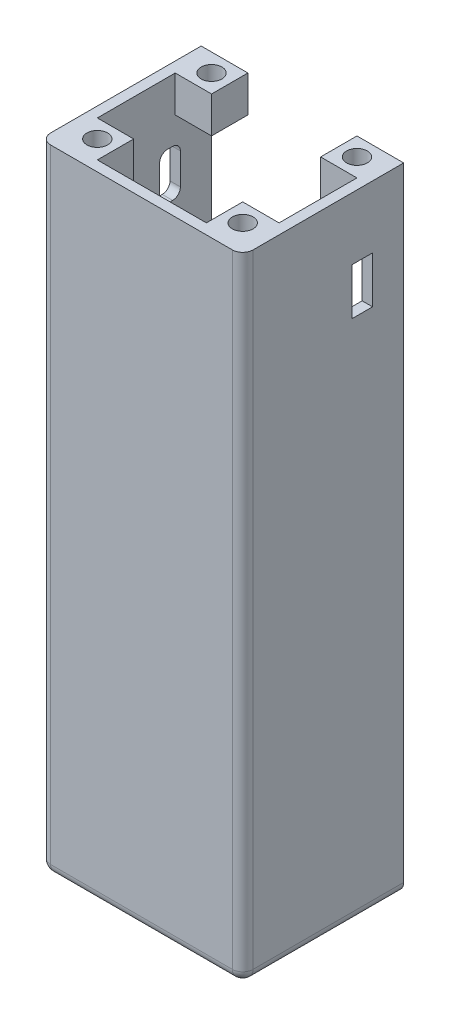
from build123d import *

# Parameters (mm, degrees)
SKETCH1_W            = 39
SKETCH1_H            = 122
BOSS_EXTRUDE2_DEPTH  = 2
SKETCH2_W            = 2
SKETCH2_H            = 122
BOSS_EXTRUDE3_DEPTH  = 25
SKETCH3_W            = 2
SKETCH3_H            = 122
BOSS_EXTRUDE4_DEPTH  = 25
SKETCH4_W            = 35
SKETCH4_H            = 2
BOSS_EXTRUDE5_DEPTH  = 25
FILLET2_R            = 2
BOSS_EXTRUDE7_DEPTH  = 4
CUT_EXTRUDE2_DEPTH   = 4
SKETCH5_W            = 4
SKETCH5_H            = 9
CUT_EXTRUDE3_DEPTH   = 4
FILLET4_R            = 2
SKETCH8_W            = 7
SKETCH8_H            = 7
BOSS_EXTRUDE8_DEPTH  = 7
SKETCH9_W            = 7
SKETCH9_H            = 7
BOSS_EXTRUDE10_DEPTH = 7
SKETCH10_R           = 2
CUT_EXTRUDE6_DEPTH   = 7
SKETCH11_W           = 7
SKETCH11_H           = 7
BOSS_EXTRUDE11_DEPTH = 7
SKETCH12_R           = 2
CUT_EXTRUDE7_DEPTH   = 7


with BuildPart() as part:
    # Sketch1 → Boss-Extrude2 (new body)
    with BuildSketch(Plane.XY):
        with Locations((19.5, 61)):
            Rectangle(SKETCH1_W, SKETCH1_H)
    extrude(amount=BOSS_EXTRUDE2_DEPTH)

    # Sketch2 → Boss-Extrude3 (add)
    with BuildSketch(Plane(origin=(0, 0, 0), x_dir=(-1, 0, 0), z_dir=(0, 0, -1))):
        with Locations((-38, 61)):
            Rectangle(SKETCH2_W, SKETCH2_H)
    extrude(amount=BOSS_EXTRUDE3_DEPTH)

    # Sketch3 → Boss-Extrude4 (add)
    with BuildSketch(Plane(origin=(0, 0, 0), x_dir=(-1, 0, 0), z_dir=(0, 0, -1))):
        with Locations((-1, 61)):
            Rectangle(SKETCH3_W, SKETCH3_H)
    extrude(amount=BOSS_EXTRUDE4_DEPTH)

    # Sketch4 → Boss-Extrude5 (add)
    with BuildSketch(Plane(origin=(0, 0, 0), x_dir=(-1, 0, 0), z_dir=(0, 0, -1))):
        with Locations((-19.5, 1)):
            Rectangle(SKETCH4_W, SKETCH4_H)
    extrude(amount=BOSS_EXTRUDE5_DEPTH)

    # Fillet2
    fillet2_edges = [part.edges().sort_by_distance(p)[0] for p in [
        (19.5, 0, 2),
        (0, 0, -11.5),
        (39, 0, -11.5),
    ]]
    fillet(fillet2_edges, radius=FILLET2_R)

    # Sketch6 → Boss-Extrude7 (add)
    with BuildSketch(Plane(origin=(0, 0, -25), x_dir=(-1, 0, 0), z_dir=(0, 0, -1))):
        with BuildLine():
            Line((-2, 122), (0, 122))
            Line((0, 122), (0, 2))
            ThreePointArc((0, 2), (-0.585786438, 0.585786438), (-2, 0))
            Line((-2, 0), (-37, 0))
            ThreePointArc((-37, 0), (-38.414213562, 0.585786438), (-39, 2))
            Line((-39, 2), (-39, 122))
            Line((-39, 122), (-37, 122))
            Line((-37, 122), (-37, 2))
            Line((-37, 2), (-2, 2))
            Line((-2, 2), (-2, 122))
        make_face()
    extrude(amount=BOSS_EXTRUDE7_DEPTH)

    # Sketch7 → Cut-Extrude2 (cut)
    with BuildSketch(Plane.ZY):
        with BuildLine():
            Line((-21.5, 110), (-20.5, 110))
            ThreePointArc((-20.5, 110), (-19.439339828, 109.560660172), (-19, 108.5))
            Line((-19, 108.5), (-19, 102.5))
            ThreePointArc((-19, 102.5), (-19.439339828, 101.439339828), (-20.5, 101))
            Line((-20.5, 101), (-21.5, 101))
            ThreePointArc((-21.5, 101), (-22.560660172, 101.439339828), (-23, 102.5))
            Line((-23, 102.5), (-23, 108.5))
            ThreePointArc((-23, 108.5), (-22.560660172, 109.560660172), (-21.5, 110))
        make_face()
    extrude(amount=-CUT_EXTRUDE2_DEPTH, mode=Mode.SUBTRACT)

    # Sketch5 → Cut-Extrude3 (cut)
    with BuildSketch(Plane(origin=(39, 0, 0), x_dir=(0, 0, -1), z_dir=(1, 0, 0))):
        with Locations((21, 105.5)):
            Rectangle(SKETCH5_W, SKETCH5_H)
    extrude(amount=-CUT_EXTRUDE3_DEPTH, mode=Mode.SUBTRACT)

    # Fillet4
    # the kernel refuses this fillet: 2 mm, written as the material it takes off along each edge
    with BuildSketch(Plane(origin=(37, 2, 0), x_dir=(1, 0, 0), z_dir=(0, 0, 1))) as fillet4_piece_1_section:
        Polygon((0, 0), (FILLET4_R, 0), (FILLET4_R, -FILLET4_R), (0, -FILLET4_R), align=None)
    fillet4_piece_1 = extrude(amount=FILLET4_R, mode=Mode.PRIVATE)
    fillet4_piece_1 = fillet4_piece_1 - Plane(origin=(37, 2, 0), x_dir=(-0.7071067811865476, 0.7071067811865475, 0), z_dir=(0, 0, 1)) * Sphere(FILLET4_R, mode=Mode.PRIVATE)
    add(fillet4_piece_1, mode=Mode.SUBTRACT)
    with BuildSketch(Plane(origin=(2, 2, 0), x_dir=(0, 0, 1), z_dir=(-1, 0, 0))) as fillet4_piece_2_section:
        Polygon((0, 0), (FILLET4_R, 0), (FILLET4_R, -FILLET4_R), (0, -FILLET4_R), align=None)
    fillet4_piece_2 = extrude(amount=FILLET4_R, mode=Mode.PRIVATE)
    fillet4_piece_2 = fillet4_piece_2 - Plane(origin=(2, 2, 0), x_dir=(0, 0.7071067811865475, -0.7071067811865475), z_dir=(-1, 0, 0)) * Sphere(FILLET4_R, mode=Mode.PRIVATE)
    add(fillet4_piece_2, mode=Mode.SUBTRACT)
    with BuildSketch(Plane(origin=(0, 2, 2), x_dir=(0, 0, -1), z_dir=(0, 1, 0))) as fillet4_piece_3:
        with BuildLine():
            CenterArc((FILLET4_R, -FILLET4_R), FILLET4_R, 90, 90)
            Line((0, -FILLET4_R), (0, 0))
            Line((0, 0), (FILLET4_R, 0))
        make_face()
    extrude(amount=125, mode=Mode.SUBTRACT)
    with BuildSketch(Plane(origin=(39, 127, 2), x_dir=(-1, 0, 0), z_dir=(0, -1, 0))) as fillet4_piece_4:
        with BuildLine():
            CenterArc((FILLET4_R, FILLET4_R), FILLET4_R, 180, 90)
            Line((0, FILLET4_R), (0, 0))
            Line((0, 0), (FILLET4_R, 0))
        make_face()
    extrude(amount=125, mode=Mode.SUBTRACT)

    # Sketch8 → Boss-Extrude8 (add)
    with BuildSketch(Plane(origin=(0, 0, -29), x_dir=(-1, 0, 0), z_dir=(0, 0, -1))):
        with Locations((-33.5, 5.5)):
            Rectangle(SKETCH8_W, SKETCH8_H)
    extrude(amount=-BOSS_EXTRUDE8_DEPTH)

    # Sketch9 → Boss-Extrude10 (add)
    with BuildSketch(Plane(origin=(0, 0, -29), x_dir=(-1, 0, 0), z_dir=(0, 0, -1))):
        with Locations((-5.5, 5.5)):
            Rectangle(SKETCH9_W, SKETCH9_H)
    extrude(amount=-BOSS_EXTRUDE10_DEPTH)

    # Sketch10 → Cut-Extrude6 (cut)
    with BuildSketch(Plane(origin=(0, 0, -29), x_dir=(-1, 0, 0), z_dir=(0, 0, -1))):
        with Locations((-33.5, 5.5)):
            Circle(SKETCH10_R)
        with Locations((-5.5, 5.5)):
            Circle(SKETCH10_R)
    extrude(amount=-CUT_EXTRUDE6_DEPTH, mode=Mode.SUBTRACT)

    # Sketch11 → Boss-Extrude11 (add)
    with BuildSketch(Plane(origin=(0, 122, 0), x_dir=(1, 0, 0), z_dir=(0, 1, 0))):
        with Locations((5.5, 3.5)):
            Rectangle(SKETCH11_W, SKETCH11_H)
        with Locations((33.5, 3.5)):
            Rectangle(SKETCH11_W, SKETCH11_H)
        with Locations((5.5, 25.5)):
            Rectangle(SKETCH11_W, SKETCH11_H)
        with Locations((33.5, 25.5)):
            Rectangle(SKETCH11_W, SKETCH11_H)
    extrude(amount=-BOSS_EXTRUDE11_DEPTH)

    # Sketch12 → Cut-Extrude7 (cut)
    with BuildSketch(Plane(origin=(0, 122, 0), x_dir=(1, 0, 0), z_dir=(0, 1, 0))):
        with Locations(Location((5.5, 25.5, 0), (0, 0, 270))):
            Circle(SKETCH12_R)
        with Locations(Location((33.5, 25.5, 0), (0, 0, 270))):
            Circle(SKETCH12_R)
        with Locations(Location((5.5, 3.5, 0), (0, 0, 270))):
            Circle(SKETCH12_R)
        with Locations(Location((33.5, 3.5, 0), (0, 0, 270))):
            Circle(SKETCH12_R)
    extrude(amount=-CUT_EXTRUDE7_DEPTH, mode=Mode.SUBTRACT)


solid = part.part
